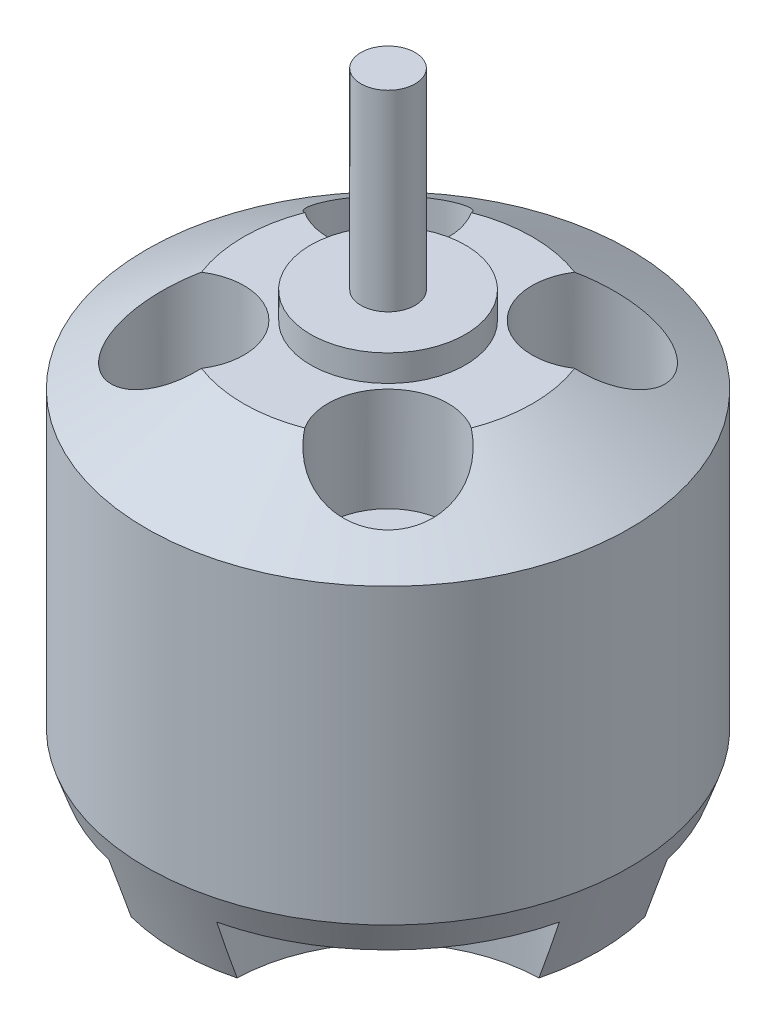
from build123d import *

# Parameters (mm, degrees)
SKETCH2_R          = 8.909599774
SKETCH2_R_2        = 1.27
CUT_EXTRUDE1_DEPTH = 3.429
SKETCH3_R          = 3.4671
CUT_EXTRUDE2_DEPTH = 5.969


with BuildPart() as part:
    # Sketch1 → Revolve1 (revolve)
    with BuildSketch(Plane.XY):
        Polygon((5.172075, -13.5255), (6.956425, -8.4455), (6.956425, 8.4455), (1.362075, 11.8745), (-2.498725, 11.8745), (-2.498725, 13.3985), (-5.394325, 13.3985), (-5.394325, 24.4475), (-6.956425, 24.4475), (-6.956425, -14.7955), (-5.394325, -14.7955), (-5.394325, -13.5255), align=None)
    revolve(axis=Axis((-6.956425, 8.4455, 0), (0, -1, 0)))

    # Sketch2 → Cut-Extrude1 (cut)
    with BuildSketch(Plane.XZ.offset(13.5255)):
        with Locations((5.001174774, 11.957599774)):
            Circle(SKETCH2_R)
        with Locations((-18.914024774, 11.957599774)):
            Circle(SKETCH2_R)
        with Locations((-18.914024774, -11.957599774)):
            Circle(SKETCH2_R)
        with Locations((5.001174774, -11.957599774)):
            Circle(SKETCH2_R)
        with Locations((-6.956425, 9.4488)):
            Circle(SKETCH2_R_2)
        with Locations((2.771775, 0)):
            Circle(SKETCH2_R_2)
        with Locations((-6.956425, -9.4488)):
            Circle(SKETCH2_R_2)
        with Locations((-16.684625, 0)):
            Circle(SKETCH2_R_2)
    extrude(amount=-CUT_EXTRUDE1_DEPTH, mode=Mode.SUBTRACT)

    # Sketch3 → Cut-Extrude2 (cut)
    with BuildSketch(Plane(origin=(0, 11.8745, 0), x_dir=(1, 0, 0), z_dir=(0, 1, 0))):
        with Locations((-1.076325, 5.8801)):
            Circle(SKETCH3_R)
        with Locations((-1.076325, -5.8801)):
            Circle(SKETCH3_R)
        with Locations((-12.836525, -5.8801)):
            Circle(SKETCH3_R)
        with Locations((-12.836525, 5.8801)):
            Circle(SKETCH3_R)
    extrude(amount=-CUT_EXTRUDE2_DEPTH, mode=Mode.SUBTRACT)


solid = part.part
